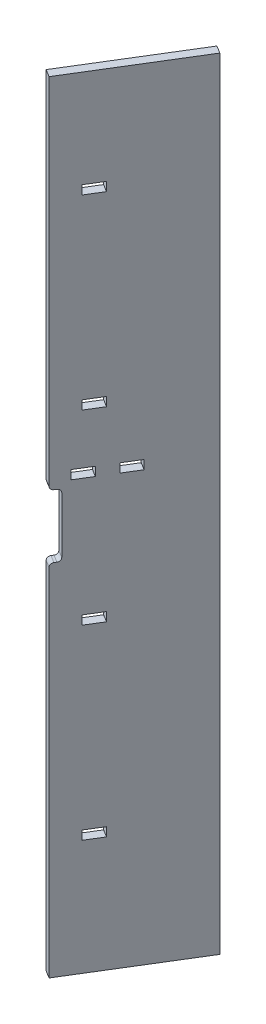
from build123d import *

# Parameters (mm, degrees)
SKETCH2_W               = 6.35
SKETCH2_H               = 88.9
BOSS_EXTRUDE1_DEPTH     = 558.8
SKETCH3_W               = 12.7
SKETCH3_H               = 6.35
CUT_EXTRUDE1_DEPTH      = 563.153290951
CUT_EXTRUDE2_DEPTH      = 563.153290951
CUT_EXTRUDE2_DEPTH_BACK = 563.153290951
SKETCH4_W               = 6.616218053
SKETCH4_H               = 45.155050505
FILLET1_R               = 2.54
SKETCH5_W               = 12.698198085
SKETCH5_H               = 6.35
CUT_EXTRUDE3_DEPTH      = 563.169533032
LPATTERN1_COUNT         = 4
LPATTERN1_PITCH         = 133.35


with BuildPart() as part:
    # Sketch2 → Boss-Extrude1 (new body)
    with BuildSketch(Plane(origin=(-119.898718407, 0, -90.007594481), x_dir=(-0.8523151338955438, 0, -0.5230285962857302), z_dir=(0, 1, 0))):
        with Locations((-41.275, 0)):
            Rectangle(SKETCH2_W, SKETCH2_H)
    extrude(amount=BOSS_EXTRUDE1_DEPTH)

    # Sketch3 → Cut-Extrude1 (cut, through all)
    with BuildSketch(Plane(origin=(-89.338000118, 0, -54.822831296), x_dir=(0.5230285962857302, -1.4972728240262083e-15, -0.8523151338955438), z_dir=(0.8523151338955437, 0, 0.5230285962857301))):
        with Locations((-12.7, 310.13)):
            Rectangle(SKETCH3_W, SKETCH3_H)
        with Locations((12.7, 310.13)):
            Rectangle(SKETCH3_W, SKETCH3_H)
    extrude(amount=-CUT_EXTRUDE1_DEPTH, mode=Mode.SUBTRACT)

    # Sketch4 → Cut-Extrude2 (cut, two sides: drawn at the far end of the back side and taken through both)
    with BuildSketch(Plane(origin=(-89.338000118, 0, -54.822831296), x_dir=(0.5230285962857303, 0, -0.8523151338955438), z_dir=(0.8523151338955437, 0, 0.5230285962857302)).offset(-CUT_EXTRUDE2_DEPTH_BACK)):
        with Locations((-27.137514417, 279.716594868)):
            Rectangle(SKETCH4_W, SKETCH4_H)
    extrude(amount=CUT_EXTRUDE2_DEPTH + CUT_EXTRUDE2_DEPTH_BACK, mode=Mode.SUBTRACT)

    # Fillet1
    fillet1_edges = [part.edges().sort_by_distance(p)[0] for p in [
        (-107.96803236, 257.139069615, -30.534181467),
        (-104.507561119, 257.139069615, -36.173284244),
        (-107.96803236, 302.29412012, -30.534181467),
        (-104.507561119, 302.29412012, -36.173284244),
    ]]
    fillet(fillet1_edges, radius=FILLET1_R)

    # Sketch5 → Cut-Extrude3 (cut, through all)
    with BuildSketch(Plane(origin=(-94.750201218, 0, -58.144062882), x_dir=(-0.5230285962857303, 0, 0.8523151338955438), z_dir=(-0.8523151338955437, 0, -0.5230285962857302))):
        with Locations((6.885284387, 485.775)):
            Rectangle(SKETCH5_W, SKETCH5_H)
    cut_extrude3 = extrude(amount=-CUT_EXTRUDE3_DEPTH, mode=Mode.SUBTRACT)

    # LPattern1: Cut-Extrude3 ×4
    with Locations(*[(0, -i * LPATTERN1_PITCH, 0) for i in range(1, LPATTERN1_COUNT)]):
        add(cut_extrude3, mode=Mode.SUBTRACT)


solid = part.part
